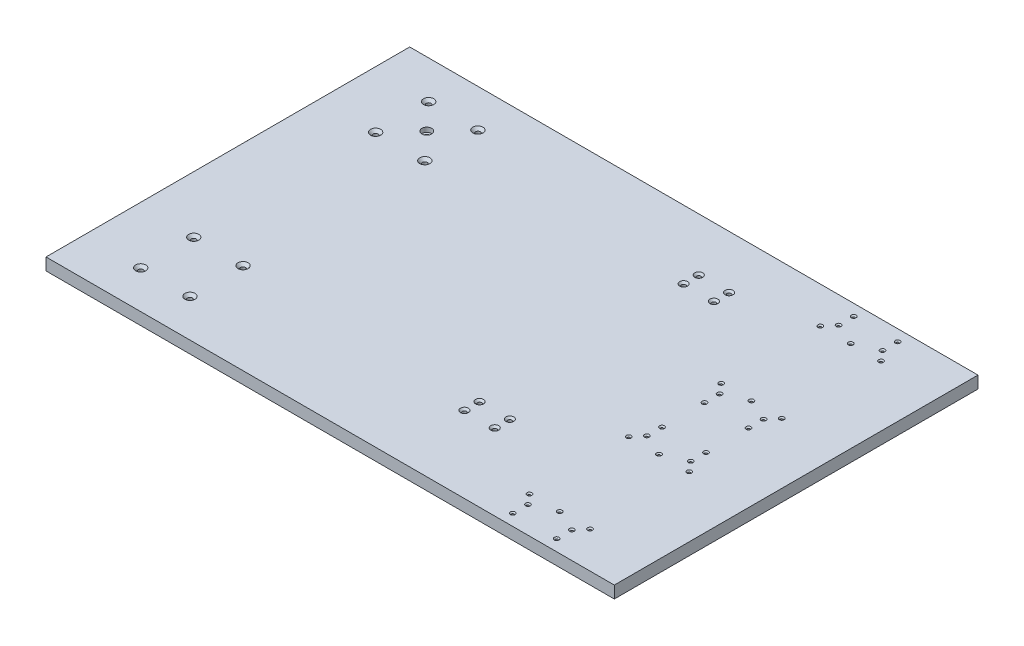
from build123d import *

# Parameters (mm, degrees)
SZKIC1_W                                             = 750
SZKIC1_H                                             = 480
DODANIE_WYCI_GNI_CIE1_DEPTH                          = 16
POG_BIENIE_STO_KOWE_POD_M3_WKR_T_DO_2_COUNT          = 2
POG_BIENIE_STO_KOWE_POD_M3_WKR_T_DO_2_PITCH          = 34.785054262
POG_BIENIE_STO_KOWE_POD_M3_WKR_T_DO_3_COUNT          = 2
POG_BIENIE_STO_KOWE_POD_M3_WKR_T_DO_3_PITCH          = 76.485292704
POG_BIENIE_STO_KOWE_POD_M3_WKR_T_DO_4_COUNT          = 2
POG_BIENIE_STO_KOWE_POD_M3_WKR_T_DO_4_PITCH          = 70.213958726
POG_BIENIE_STO_KOWE_POD_M3_WKR_T_DO_5_COUNT          = 2
POG_BIENIE_STO_KOWE_POD_M3_WKR_T_DO_5_PITCH          = 40
POG_BIENIE_STO_KOWE_POD_M3_WKR_T_DO_6_COUNT          = 2
POG_BIENIE_STO_KOWE_POD_M3_WKR_T_DO_6_PITCH          = 80
POG_BIENIE_STO_KOWE_POD_M3_WKR_T_DO_7_COUNT          = 2
POG_BIENIE_STO_KOWE_POD_M3_WKR_T_DO_7_PITCH          = 17.029386366
POG_BIENIE_STO_KOWE_POD_M6_WKR_T_USTALAJ_D           = 6.4
POG_BIENIE_STO_KOWE_POD_M6_WKR_T_USTALAJ_DEPTH       = 26
POG_BIENIE_STO_KOWE_POD_M6_WKR_T_USTALAJ_CSINK_D     = 13.44
POG_BIENIE_STO_KOWE_POD_M6_WKR_T_USTALAJ_CSINK_ANGLE = 90
POG_BIENIE_STO_KOWE_POD_M6_WKR_T_USTALAJ_TIP         = 1.922753981
POG_BIENIE_STO_KOWE_POD_M5_WKR_T_DO_CZ_C_D           = 5.5
POG_BIENIE_STO_KOWE_POD_M5_WKR_T_DO_CZ_C_DEPTH       = 17
POG_BIENIE_STO_KOWE_POD_M5_WKR_T_DO_CZ_C_CSINK_D     = 10.4
POG_BIENIE_STO_KOWE_POD_M5_WKR_T_DO_CZ_C_CSINK_ANGLE = 90
POG_BIENIE_STO_KOWE_POD_M5_WKR_T_DO_CZ_C_TIP         = 1.652366702
POG_BIENIE_WALCOWE_POD_M6_WKR_T_DO_CZ_CI_D           = 6.6
POG_BIENIE_WALCOWE_POD_M6_WKR_T_DO_CZ_CI_CBORE_D     = 13
POG_BIENIE_WALCOWE_POD_M6_WKR_T_DO_CZ_CI_CBORE_DEPTH = 6


# Read off the part's stored shape, not the designer's step: Lustro2, Lustro3
with BuildPart() as part:
    # Szkic1 → Dodanie-wyciągnięcie1 (new body)
    with BuildSketch(Plane(origin=(0, 0, 0), x_dir=(1, 0, 0), z_dir=(0, 1, 0))):
        Rectangle(SZKIC1_W, SZKIC1_H)
    extrude(amount=DODANIE_WYCI_GNI_CIE1_DEPTH)

    # Szkic7 → Pogłębienie stożkowe pod M3 wkręt do części metalowych z łbem płaskim1 (revolve, cut)
    with BuildSketch(Plane(origin=(295, 16, -61), x_dir=(0, 0, 1), z_dir=(1, 0, 0))):
        Polygon((0, 0), (0, 40.96137699), (1.6, 40), (1.6, 1.55), (3.15, 0), align=None)
    pog_bienie_sto_kowe_pod_m3_wkr_t_do_cz_c = revolve(axis=Axis((295, 22.35, -61), (0, -1, 0)), mode=Mode.SUBTRACT)

    # Pog_bienie sto_kowe pod M3 wkr_t do  2: Pogłębienie stożkowe pod M3 wkręt do części metalowych z łbem płaskim1 ×2
    with Locations(*[Vector(-0.316227766016835, 0, 0.9486832980505148) * (i * POG_BIENIE_STO_KOWE_POD_M3_WKR_T_DO_2_PITCH) for i in range(1, POG_BIENIE_STO_KOWE_POD_M3_WKR_T_DO_2_COUNT)]):
        add(pog_bienie_sto_kowe_pod_m3_wkr_t_do_cz_c, mode=Mode.SUBTRACT)

    # Pog_bienie sto_kowe pod M3 wkr_t do  3: Pogłębienie stożkowe pod M3 wkręt do części metalowych z łbem płaskim1 ×2
    with Locations(*[Vector(-0.9021342216356464, 0, 0.43145549730400534) * (i * POG_BIENIE_STO_KOWE_POD_M3_WKR_T_DO_3_PITCH) for i in range(1, POG_BIENIE_STO_KOWE_POD_M3_WKR_T_DO_3_COUNT)]):
        add(pog_bienie_sto_kowe_pod_m3_wkr_t_do_cz_c, mode=Mode.SUBTRACT)

    # Pog_bienie sto_kowe pod M3 wkr_t do  4: Pogłębienie stożkowe pod M3 wkręt do części metalowych z łbem płaskim1 ×2
    with Locations(*[Vector(-0.9827105785204017, 0, 0.18514836986616307) * (i * POG_BIENIE_STO_KOWE_POD_M3_WKR_T_DO_4_PITCH) for i in range(1, POG_BIENIE_STO_KOWE_POD_M3_WKR_T_DO_4_COUNT)]):
        add(pog_bienie_sto_kowe_pod_m3_wkr_t_do_cz_c, mode=Mode.SUBTRACT)

    # Pog_bienie sto_kowe pod M3 wkr_t do  5: Pogłębienie stożkowe pod M3 wkręt do części metalowych z łbem płaskim1 ×2
    with Locations(*[(-i * POG_BIENIE_STO_KOWE_POD_M3_WKR_T_DO_5_PITCH, 0, 0) for i in range(1, POG_BIENIE_STO_KOWE_POD_M3_WKR_T_DO_5_COUNT)]):
        add(pog_bienie_sto_kowe_pod_m3_wkr_t_do_cz_c, mode=Mode.SUBTRACT)

    # Pog_bienie sto_kowe pod M3 wkr_t do  6: Pogłębienie stożkowe pod M3 wkręt do części metalowych z łbem płaskim1 ×2
    with Locations(*[(-i * POG_BIENIE_STO_KOWE_POD_M3_WKR_T_DO_6_PITCH, 0, 0) for i in range(1, POG_BIENIE_STO_KOWE_POD_M3_WKR_T_DO_6_COUNT)]):
        add(pog_bienie_sto_kowe_pod_m3_wkr_t_do_cz_c, mode=Mode.SUBTRACT)

    # Pog_bienie sto_kowe pod M3 wkr_t do  7: Pogłębienie stożkowe pod M3 wkręt do części metalowych z łbem płaskim1 ×2
    with Locations(*[Vector(-0.6459422414661697, 0, 0.763386285369118) * (i * POG_BIENIE_STO_KOWE_POD_M3_WKR_T_DO_7_PITCH) for i in range(1, POG_BIENIE_STO_KOWE_POD_M3_WKR_T_DO_7_COUNT)]):
        add(pog_bienie_sto_kowe_pod_m3_wkr_t_do_cz_c, mode=Mode.SUBTRACT)

    # Lustro2 outline → Lustro2 (revolve, cut)
    with BuildSketch(Plane(origin=(284, 0, -205), x_dir=(1, 0, 0), z_dir=(0, 0, 1))):
        Polygon((0, 0), (1.6, 0), (1.6, 14.45), (3.15, 16), (0, 16), align=None)
    revolve(axis=Axis((284, 0, -205), (0, 1, 0)), mode=Mode.SUBTRACT)

    # Lustro2 2 outline → Lustro2 2 (revolve, cut)
    with BuildSketch(Plane(origin=(215, 0, -192), x_dir=(1, 0, 0), z_dir=(0, 0, 1))):
        Polygon((0, 0), (1.6, 0), (1.6, 14.45), (3.15, 16), (0, 16), align=None)
    revolve(axis=Axis((215, 0, -192), (0, 1, 0)), mode=Mode.SUBTRACT)

    # Lustro2 3 outline → Lustro2 3 (revolve, cut)
    with BuildSketch(Plane(origin=(255, 0, -192), x_dir=(1, 0, 0), z_dir=(0, 0, 1))):
        Polygon((0, 0), (1.6, 0), (1.6, 14.45), (3.15, 16), (0, 16), align=None)
    revolve(axis=Axis((255, 0, -192), (0, 1, 0)), mode=Mode.SUBTRACT)

    # Lustro2 4 outline → Lustro2 4 (revolve, cut)
    with BuildSketch(Plane(origin=(226, 0, -205), x_dir=(1, 0, 0), z_dir=(0, 0, 1))):
        Polygon((0, 0), (1.6, 0), (1.6, 14.45), (3.15, 16), (0, 16), align=None)
    revolve(axis=Axis((226, 0, -205), (0, 1, 0)), mode=Mode.SUBTRACT)

    # Lustro2 5 outline → Lustro2 5 (revolve, cut)
    with BuildSketch(Plane(origin=(226, 0, -225), x_dir=(1, 0, 0), z_dir=(0, 0, 1))):
        Polygon((0, 0), (1.6, 0), (1.6, 14.45), (3.15, 16), (0, 16), align=None)
    revolve(axis=Axis((226, 0, -225), (0, 1, 0)), mode=Mode.SUBTRACT)

    # Lustro2 6 outline → Lustro2 6 (revolve, cut)
    with BuildSketch(Plane(origin=(284, 0, -225), x_dir=(1, 0, 0), z_dir=(0, 0, 1))):
        Polygon((0, 0), (1.6, 0), (1.6, 14.45), (3.15, 16), (0, 16), align=None)
    revolve(axis=Axis((284, 0, -225), (0, 1, 0)), mode=Mode.SUBTRACT)

    # Lustro2 7 outline → Lustro2 7 (revolve, cut)
    with BuildSketch(Plane(origin=(295, 0, -192), x_dir=(1, 0, 0), z_dir=(0, 0, 1))):
        Polygon((0, 0), (1.6, 0), (1.6, 14.45), (3.15, 16), (0, 16), align=None)
    revolve(axis=Axis((295, 0, -192), (0, 1, 0)), mode=Mode.SUBTRACT)

    # Lustro3 outline → Lustro3 (revolve, cut)
    with BuildSketch(Plane(origin=(284, 0, 48), x_dir=(1, 0, 0), z_dir=(0, 0, 1))):
        Polygon((0, 0), (1.6, 0), (1.6, 14.45), (3.15, 16), (0, 16), align=None)
    revolve(axis=Axis((284, 0, 48), (0, 1, 0)), mode=Mode.SUBTRACT)

    # Lustro3 2 outline → Lustro3 2 (revolve, cut)
    with BuildSketch(Plane(origin=(215, 0, 61), x_dir=(1, 0, 0), z_dir=(0, 0, 1))):
        Polygon((0, 0), (1.6, 0), (1.6, 14.45), (3.15, 16), (0, 16), align=None)
    revolve(axis=Axis((215, 0, 61), (0, 1, 0)), mode=Mode.SUBTRACT)

    # Lustro3 3 outline → Lustro3 3 (revolve, cut)
    with BuildSketch(Plane(origin=(255, 0, 61), x_dir=(1, 0, 0), z_dir=(0, 0, 1))):
        Polygon((0, 0), (1.6, 0), (1.6, 14.45), (3.15, 16), (0, 16), align=None)
    revolve(axis=Axis((255, 0, 61), (0, 1, 0)), mode=Mode.SUBTRACT)

    # Lustro3 4 outline → Lustro3 4 (revolve, cut)
    with BuildSketch(Plane(origin=(226, 0, 48), x_dir=(1, 0, 0), z_dir=(0, 0, 1))):
        Polygon((0, 0), (1.6, 0), (1.6, 14.45), (3.15, 16), (0, 16), align=None)
    revolve(axis=Axis((226, 0, 48), (0, 1, 0)), mode=Mode.SUBTRACT)

    # Lustro3 5 outline → Lustro3 5 (revolve, cut)
    with BuildSketch(Plane(origin=(226, 0, 28), x_dir=(1, 0, 0), z_dir=(0, 0, 1))):
        Polygon((0, 0), (1.6, 0), (1.6, 14.45), (3.15, 16), (0, 16), align=None)
    revolve(axis=Axis((226, 0, 28), (0, 1, 0)), mode=Mode.SUBTRACT)

    # Lustro3 6 outline → Lustro3 6 (revolve, cut)
    with BuildSketch(Plane(origin=(284, 0, 28), x_dir=(1, 0, 0), z_dir=(0, 0, 1))):
        Polygon((0, 0), (1.6, 0), (1.6, 14.45), (3.15, 16), (0, 16), align=None)
    revolve(axis=Axis((284, 0, 28), (0, 1, 0)), mode=Mode.SUBTRACT)

    # Lustro3 7 outline → Lustro3 7 (revolve, cut)
    with BuildSketch(Plane(origin=(295, 0, 61), x_dir=(1, 0, 0), z_dir=(0, 0, 1))):
        Polygon((0, 0), (1.6, 0), (1.6, 14.45), (3.15, 16), (0, 16), align=None)
    revolve(axis=Axis((295, 0, 61), (0, 1, 0)), mode=Mode.SUBTRACT)

    # Lustro3 8 outline → Lustro3 8 (revolve, cut)
    with BuildSketch(Plane(origin=(284, 0, 205), x_dir=(1, 0, 0), z_dir=(0, 0, 1))):
        Polygon((0, 0), (1.6, 0), (1.6, 14.45), (3.15, 16), (0, 16), align=None)
    revolve(axis=Axis((284, 0, 205), (0, 1, 0)), mode=Mode.SUBTRACT)

    # Lustro3 9 outline → Lustro3 9 (revolve, cut)
    with BuildSketch(Plane(origin=(215, 0, 192), x_dir=(1, 0, 0), z_dir=(0, 0, 1))):
        Polygon((0, 0), (1.6, 0), (1.6, 14.45), (3.15, 16), (0, 16), align=None)
    revolve(axis=Axis((215, 0, 192), (0, 1, 0)), mode=Mode.SUBTRACT)

    # Lustro3 10 outline → Lustro3 10 (revolve, cut)
    with BuildSketch(Plane(origin=(255, 0, 192), x_dir=(1, 0, 0), z_dir=(0, 0, 1))):
        Polygon((0, 0), (1.6, 0), (1.6, 14.45), (3.15, 16), (0, 16), align=None)
    revolve(axis=Axis((255, 0, 192), (0, 1, 0)), mode=Mode.SUBTRACT)

    # Lustro3 11 outline → Lustro3 11 (revolve, cut)
    with BuildSketch(Plane(origin=(226, 0, 205), x_dir=(1, 0, 0), z_dir=(0, 0, 1))):
        Polygon((0, 0), (1.6, 0), (1.6, 14.45), (3.15, 16), (0, 16), align=None)
    revolve(axis=Axis((226, 0, 205), (0, 1, 0)), mode=Mode.SUBTRACT)

    # Lustro3 12 outline → Lustro3 12 (revolve, cut)
    with BuildSketch(Plane(origin=(226, 0, 225), x_dir=(1, 0, 0), z_dir=(0, 0, 1))):
        Polygon((0, 0), (1.6, 0), (1.6, 14.45), (3.15, 16), (0, 16), align=None)
    revolve(axis=Axis((226, 0, 225), (0, 1, 0)), mode=Mode.SUBTRACT)

    # Lustro3 13 outline → Lustro3 13 (revolve, cut)
    with BuildSketch(Plane(origin=(284, 0, 225), x_dir=(1, 0, 0), z_dir=(0, 0, 1))):
        Polygon((0, 0), (1.6, 0), (1.6, 14.45), (3.15, 16), (0, 16), align=None)
    revolve(axis=Axis((284, 0, 225), (0, 1, 0)), mode=Mode.SUBTRACT)

    # Lustro3 14 outline → Lustro3 14 (revolve, cut)
    with BuildSketch(Plane(origin=(295, 0, 192), x_dir=(1, 0, 0), z_dir=(0, 0, 1))):
        Polygon((0, 0), (1.6, 0), (1.6, 14.45), (3.15, 16), (0, 16), align=None)
    revolve(axis=Axis((295, 0, 192), (0, 1, 0)), mode=Mode.SUBTRACT)

    # Lustro3 15 outline → Lustro3 15 (revolve, cut)
    with BuildSketch(Plane(origin=(-300, 0, 190), x_dir=(1, 0, 0), z_dir=(0, 0, 1))):
        Polygon((0, 0), (3.2, 0), (3.2, 12.48), (6.72, 16), (0, 16), align=None)
    revolve(axis=Axis((-300, 0, 190), (0, 1, 0)), mode=Mode.SUBTRACT)

    # Lustro3 16 outline → Lustro3 16 (revolve, cut)
    with BuildSketch(Plane(origin=(-300, 0, 120), x_dir=(1, 0, 0), z_dir=(0, 0, 1))):
        Polygon((0, 0), (3.2, 0), (3.2, 12.48), (6.72, 16), (0, 16), align=None)
    revolve(axis=Axis((-300, 0, 120), (0, 1, 0)), mode=Mode.SUBTRACT)

    # Lustro3 17 outline → Lustro3 17 (revolve, cut)
    with BuildSketch(Plane(origin=(-235, 0, 120), x_dir=(1, 0, 0), z_dir=(0, 0, 1))):
        Polygon((0, 0), (3.2, 0), (3.2, 12.48), (6.72, 16), (0, 16), align=None)
    revolve(axis=Axis((-235, 0, 120), (0, 1, 0)), mode=Mode.SUBTRACT)

    # Lustro3 18 outline → Lustro3 18 (revolve, cut)
    with BuildSketch(Plane(origin=(-235, 0, 190), x_dir=(1, 0, 0), z_dir=(0, 0, 1))):
        Polygon((0, 0), (3.2, 0), (3.2, 12.48), (6.72, 16), (0, 16), align=None)
    revolve(axis=Axis((-235, 0, 190), (0, 1, 0)), mode=Mode.SUBTRACT)

    # Lustro3 19 outline → Lustro3 19 (revolve, cut)
    with BuildSketch(Plane(origin=(116.5, 0, 139.3338), x_dir=(1, 0, 0), z_dir=(0, 0, 1))):
        Polygon((0, 0), (2.75, 0), (2.75, 13.55), (5.2, 16), (0, 16), align=None)
    revolve(axis=Axis((116.5, 0, 139.3338), (0, 1, 0)), mode=Mode.SUBTRACT)

    # Lustro3 20 outline → Lustro3 20 (revolve, cut)
    with BuildSketch(Plane(origin=(116.5, 0, 119.3338), x_dir=(1, 0, 0), z_dir=(0, 0, 1))):
        Polygon((0, 0), (2.75, 0), (2.75, 13.55), (5.2, 16), (0, 16), align=None)
    revolve(axis=Axis((116.5, 0, 119.3338), (0, 1, 0)), mode=Mode.SUBTRACT)

    # Lustro3 21 outline → Lustro3 21 (revolve, cut)
    with BuildSketch(Plane(origin=(76.5, 0, 119.3338), x_dir=(1, 0, 0), z_dir=(0, 0, 1))):
        Polygon((0, 0), (2.75, 0), (2.75, 13.55), (5.2, 16), (0, 16), align=None)
    revolve(axis=Axis((76.5, 0, 119.3338), (0, 1, 0)), mode=Mode.SUBTRACT)

    # Lustro3 22 outline → Lustro3 22 (revolve, cut)
    with BuildSketch(Plane(origin=(76.5, 0, 139.3338), x_dir=(1, 0, 0), z_dir=(0, 0, 1))):
        Polygon((0, 0), (2.75, 0), (2.75, 13.55), (5.2, 16), (0, 16), align=None)
    revolve(axis=Axis((76.5, 0, 139.3338), (0, 1, 0)), mode=Mode.SUBTRACT)

    # Pogłębienie stożkowe pod M6 Wkręt ustalający1
    with Locations(Plane(origin=(0, 16, 0), x_dir=(1, 0, 0), z_dir=(0, 1, 0))):
        with Locations((-235, 190), (-235, 120), (-300, 120), (-300, 190)):
            CounterSinkHole(POG_BIENIE_STO_KOWE_POD_M6_WKR_T_USTALAJ_D / 2, POG_BIENIE_STO_KOWE_POD_M6_WKR_T_USTALAJ_CSINK_D / 2, depth=POG_BIENIE_STO_KOWE_POD_M6_WKR_T_USTALAJ_DEPTH, counter_sink_angle=POG_BIENIE_STO_KOWE_POD_M6_WKR_T_USTALAJ_CSINK_ANGLE)
            with Locations((0, 0, -(POG_BIENIE_STO_KOWE_POD_M6_WKR_T_USTALAJ_DEPTH + POG_BIENIE_STO_KOWE_POD_M6_WKR_T_USTALAJ_TIP / 2))):  # 118° drill point
                Cone(0, POG_BIENIE_STO_KOWE_POD_M6_WKR_T_USTALAJ_D / 2, POG_BIENIE_STO_KOWE_POD_M6_WKR_T_USTALAJ_TIP, mode=Mode.SUBTRACT)

    # Pogłębienie stożkowe pod M5 wkręt do części metalowych z łbem soczewkowym2
    with Locations(Plane(origin=(0, 16, 0), x_dir=(1, 0, 0), z_dir=(0, 1, 0))):
        with Locations((76.5, 170), (76.5, 150), (116.5, 150), (116.5, 170)):
            CounterSinkHole(POG_BIENIE_STO_KOWE_POD_M5_WKR_T_DO_CZ_C_D / 2, POG_BIENIE_STO_KOWE_POD_M5_WKR_T_DO_CZ_C_CSINK_D / 2, depth=POG_BIENIE_STO_KOWE_POD_M5_WKR_T_DO_CZ_C_DEPTH, counter_sink_angle=POG_BIENIE_STO_KOWE_POD_M5_WKR_T_DO_CZ_C_CSINK_ANGLE)
            with Locations((0, 0, -(POG_BIENIE_STO_KOWE_POD_M5_WKR_T_DO_CZ_C_DEPTH + POG_BIENIE_STO_KOWE_POD_M5_WKR_T_DO_CZ_C_TIP / 2))):  # 118° drill point
                Cone(0, POG_BIENIE_STO_KOWE_POD_M5_WKR_T_DO_CZ_C_D / 2, POG_BIENIE_STO_KOWE_POD_M5_WKR_T_DO_CZ_C_TIP, mode=Mode.SUBTRACT)

    # Pogłębienie walcowe pod M6 wkręt do części metalowych z łbem stożkowym ściętym1 (through all)
    with Locations(Plane(origin=(0, 16, 0), x_dir=(1, 0, 0), z_dir=(0, 1, 0))):
        with Locations((-267.5, 155)):
            CounterBoreHole(POG_BIENIE_WALCOWE_POD_M6_WKR_T_DO_CZ_CI_D / 2, POG_BIENIE_WALCOWE_POD_M6_WKR_T_DO_CZ_CI_CBORE_D / 2, POG_BIENIE_WALCOWE_POD_M6_WKR_T_DO_CZ_CI_CBORE_DEPTH)


solid = part.part
